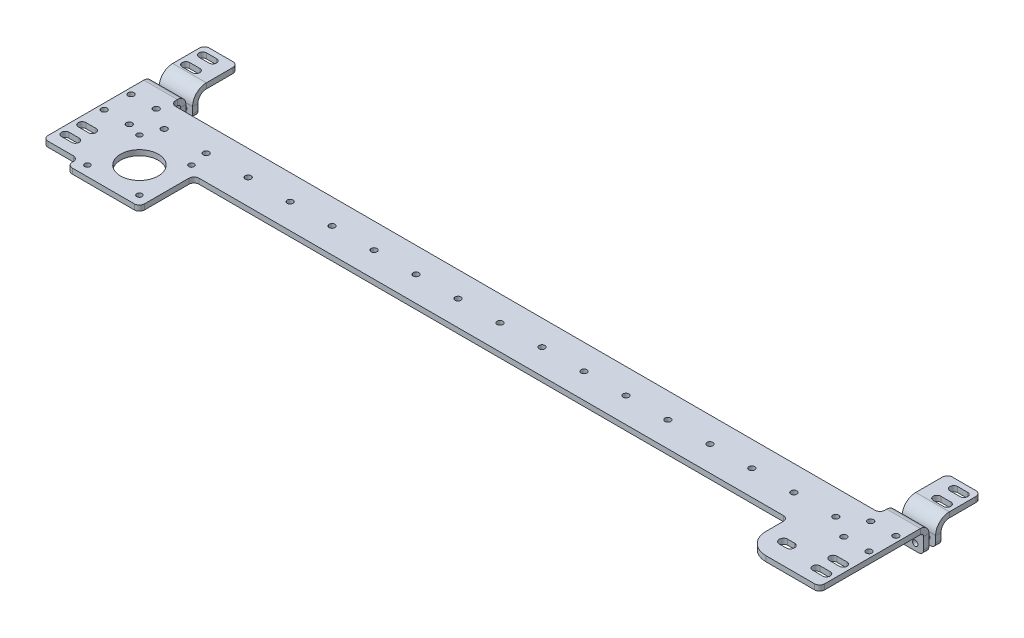
from build123d import *

# Parameters (mm, degrees)
SKETCH1_W                    = 462.5
SKETCH1_H                    = 30
SKETCH1_R                    = 1.75
BOSS_EXTRUDE1_DEPTH          = 3.175
SKETCH2_R                    = 1.6
BOSS_EXTRUDE2_DEPTH          = 3.175
SKETCH2_3_R                  = 1.6
CUT_EXTRUDE1_DEPTH           = 3.175
SKETCH14_W                   = 20
SKETCH14_H                   = 3.175
BOSS_EXTRUDE4_DEPTH          = 6
FILLET1_R                    = 3
EDGE_FLANGE1_START           = -231.25
EDGE_FLANGE1_DEPTH           = 462.5
EDGE_FLANGE1_START_2         = -211.25
EDGE_FLANGE1_2_DEPTH         = 422.5
EDGE_FLANGE1_3_DEPTH         = 20
EDGE_FLANGE1_START_3         = 211.25
EDGE_FLANGE1_4_DEPTH         = 20
FILLET2_R                    = 3
BASE_FLANGE1_START           = 3.175
BASE_FLANGE1_DEPTH           = 3.175
EDGE_FLANGE2_STRIP_W         = 22.7
EDGE_FLANGE2_STRIP_H         = 3.175
EDGE_FLANGE2_STRIP_CUT_DEPTH = 20
EDGE_FLANGE2_DEPTH           = 20
CUT_EXTRUDE2_DEPTH           = 3.175
FILLET3_R                    = 3
SKETCH41_R                   = 1.6
CUT_EXTRUDE3_DEPTH           = 245.609312221


# Read off the part's stored shape, not the designer's step: Edge-Flange1
# Sheet-metal steps are written as plain solids
with BuildPart() as part:
    # Sketch1 → Boss-Extrude1 (new body)
    with BuildSketch(Plane(origin=(0, 0, 0), x_dir=(1, 0, 0), z_dir=(0, 1, 0))):
        Rectangle(SKETCH1_W, SKETCH1_H)
        with Locations(Location((-227.75, 8, 0), (0, 0, 270))):
            Circle(SKETCH1_R, mode=Mode.SUBTRACT)
        with Locations(Location((-212.75, 8, 0), (0, 0, 270))):
            Circle(SKETCH1_R, mode=Mode.SUBTRACT)
        with Locations(Location((-227.75, -8, 0), (0, 0, 270))):
            Circle(SKETCH1_R, mode=Mode.SUBTRACT)
        with Locations(Location((-212.75, -8, 0), (0, 0, 270))):
            Circle(SKETCH1_R, mode=Mode.SUBTRACT)
        with Locations(Location((-200, 0, 0), (0, 0, 270))):
            Circle(SKETCH1_R, mode=Mode.SUBTRACT)
        with Locations(Location((-175, 0, 0), (0, 0, 270))):
            Circle(SKETCH1_R, mode=Mode.SUBTRACT)
        with Locations(Location((-150, 0, 0), (0, 0, 270))):
            Circle(SKETCH1_R, mode=Mode.SUBTRACT)
        with Locations(Location((-125, 0, 0), (0, 0, 270))):
            Circle(SKETCH1_R, mode=Mode.SUBTRACT)
        with Locations(Location((-100, 0, 0), (0, 0, 270))):
            Circle(SKETCH1_R, mode=Mode.SUBTRACT)
        with Locations(Location((-75, 0, 0), (0, 0, 270))):
            Circle(SKETCH1_R, mode=Mode.SUBTRACT)
        with Locations(Location((-50, 0, 0), (0, 0, 270))):
            Circle(SKETCH1_R, mode=Mode.SUBTRACT)
        with Locations(Location((-25, 0, 0), (0, 0, 270))):
            Circle(SKETCH1_R, mode=Mode.SUBTRACT)
        with Locations(Location((0, 0, 0), (0, 0, 270))):
            Circle(SKETCH1_R, mode=Mode.SUBTRACT)
        with Locations(Location((25, 0, 0), (0, 0, 270))):
            Circle(SKETCH1_R, mode=Mode.SUBTRACT)
        with Locations(Location((50, 0, 0), (0, 0, 270))):
            Circle(SKETCH1_R, mode=Mode.SUBTRACT)
        with Locations(Location((75, 0, 0), (0, 0, 270))):
            Circle(SKETCH1_R, mode=Mode.SUBTRACT)
        with Locations(Location((212.75, -8, 0), (0, 0, 90))):
            Circle(SKETCH1_R, mode=Mode.SUBTRACT)
        with Locations(Location((212.75, 8, 0), (0, 0, 90))):
            Circle(SKETCH1_R, mode=Mode.SUBTRACT)
        with Locations(Location((227.75, -8, 0), (0, 0, 90))):
            Circle(SKETCH1_R, mode=Mode.SUBTRACT)
        with Locations(Location((227.75, 8, 0), (0, 0, 90))):
            Circle(SKETCH1_R, mode=Mode.SUBTRACT)
        with Locations(Location((100, 0, 0), (0, 0, 270))):
            Circle(SKETCH1_R, mode=Mode.SUBTRACT)
        with Locations(Location((125, 0, 0), (0, 0, 270))):
            Circle(SKETCH1_R, mode=Mode.SUBTRACT)
        with Locations(Location((150, 0, 0), (0, 0, 270))):
            Circle(SKETCH1_R, mode=Mode.SUBTRACT)
        with Locations(Location((175, 0, 0), (0, 0, 270))):
            Circle(SKETCH1_R, mode=Mode.SUBTRACT)
        with Locations(Location((200, 0, 0), (0, 0, 270))):
            Circle(SKETCH1_R, mode=Mode.SUBTRACT)
    extrude(amount=BOSS_EXTRUDE1_DEPTH)

    # Sketch2 → Boss-Extrude2 (add)
    # profile 1 of 2: a face of its own
    with BuildSketch(Plane(origin=(0, 3.175, 0), x_dir=(1, 0, 0), z_dir=(0, 1, 0))):
        with BuildLine():
            Line((-231.25, -40.9), (-210.25, -40.9))
            Line((-210.25, -40.9), (-210.25, -47.5))
            Line((-210.25, -47.5), (-167.25, -47.5))
            Line((-167.25, -47.5), (-167.25, -15))
            Line((-167.25, -15), (-186.391504717, -15))
            ThreePointArc((-186.391504717, -15), (-180.000840842, -18.927891825), (-177.5, -26))
            ThreePointArc((-177.5, -26), (-195.822108175, -34.749159158), (-191.108495283, -15))
            Line((-191.108495283, -15), (-231.25, -15))
            Line((-231.25, -15), (-231.25, -40.9))
        make_face()
        with Locations(Location((-204.25, -41.5, 0), (0, 0, 270))):
            Circle(SKETCH2_R, mode=Mode.SUBTRACT)
        with Locations(Location((-173.25, -41.5, 0), (0, 0, 270))):
            Circle(SKETCH2_R, mode=Mode.SUBTRACT)
        with BuildLine():
            Line((-220.65, -34.5), (-226.65, -34.5))
            ThreePointArc((-226.65, -34.5), (-228.9, -32.25), (-226.65, -30))
            Line((-226.65, -30), (-220.65, -30))
            ThreePointArc((-220.65, -30), (-218.4, -32.25), (-220.65, -34.5))
        make_face(mode=Mode.SUBTRACT)
        with BuildLine():
            Line((-220.65, -24.5), (-226.65, -24.5))
            ThreePointArc((-226.65, -24.5), (-228.9, -22.25), (-226.65, -20))
            Line((-226.65, -20), (-220.65, -20))
            ThreePointArc((-220.65, -20), (-218.4, -22.25), (-220.65, -24.5))
        make_face(mode=Mode.SUBTRACT)
    # profile 2 of 2: a face of its own
    with BuildSketch(Plane(origin=(0, 3.175, 0), x_dir=(1, 0, 0), z_dir=(0, 1, 0))):
        with BuildLine():
            Line((231.25, -15), (186.75, -15))
            Line((186.75, -15), (186.75, -28.4))
            ThreePointArc((186.75, -28.4), (190.411165235, -37.238834765), (199.25, -40.9))
            Line((199.25, -40.9), (231.25, -40.9))
            Line((231.25, -40.9), (231.25, -15))
        make_face()
        with BuildLine():
            ThreePointArc((226.65, -30), (228.9, -32.25), (226.65, -34.5))
            Line((226.65, -34.5), (220.65, -34.5))
            ThreePointArc((220.65, -34.5), (218.4, -32.25), (220.65, -30))
            Line((220.65, -30), (226.65, -30))
        make_face(mode=Mode.SUBTRACT)
        with BuildLine():
            ThreePointArc((197.25, -30.9), (194.75, -28.4), (197.25, -25.9))
            Line((197.25, -25.9), (201.25, -25.9))
            ThreePointArc((201.25, -25.9), (203.75, -28.4), (201.25, -30.9))
            Line((201.25, -30.9), (197.25, -30.9))
        make_face(mode=Mode.SUBTRACT)
        with BuildLine():
            ThreePointArc((226.65, -20), (228.9, -22.25), (226.65, -24.5))
            Line((226.65, -24.5), (220.65, -24.5))
            ThreePointArc((220.65, -24.5), (218.4, -22.25), (220.65, -20))
            Line((220.65, -20), (226.65, -20))
        make_face(mode=Mode.SUBTRACT)
    extrude(amount=-BOSS_EXTRUDE2_DEPTH)

    # Sketch2<3> → Cut-Extrude1 (cut)
    with BuildSketch(Plane(origin=(0, 3.175, 0), x_dir=(1, 0, 0), z_dir=(0, 1, 0))):
        with Locations(Location((-204.25, -10.5, 0), (0, 0, 270))):
            Circle(SKETCH2_3_R)
        with Locations(Location((-173.25, -10.5, 0), (0, 0, 270))):
            Circle(SKETCH2_3_R)
        with BuildLine():
            ThreePointArc((-186.391504717, -15), (-188.75, -14.75), (-191.108495283, -15))
            Line((-191.108495283, -15), (-186.391504717, -15))
        make_face()
        with BuildLine():
            Line((-186.391504717, -15), (-191.108495283, -15))
            ThreePointArc((-191.108495283, -15), (-195.822108175, -34.749159158), (-177.5, -26))
            ThreePointArc((-177.5, -26), (-180.000840842, -18.927891825), (-186.391504717, -15))
        make_face()
    extrude(amount=-CUT_EXTRUDE1_DEPTH, mode=Mode.SUBTRACT)

    # Sketch14 → Boss-Extrude4 (add)
    with BuildSketch(Plane(origin=(0, 0, -15), x_dir=(-1, 0, 0), z_dir=(0, 0, -1))):
        with Locations((-221.25, 1.5875)):
            Rectangle(SKETCH14_W, SKETCH14_H)
        with Locations((221.25, 1.5875)):
            Rectangle(SKETCH14_W, SKETCH14_H)
    extrude(amount=BOSS_EXTRUDE4_DEPTH)

    # Fillet1
    fillet1_edges = [part.edges().sort_by_distance(p)[0] for p in [
        (-167.25, 1.5875, 15),
        (-167.25, 1.5875, 47.5),
        (-210.25, 1.5875, 47.5),
        (-210.25, 1.5875, 40.9),
        (-231.25, 1.5875, 40.9),
        (186.75, 1.5875, 15),
        (231.25, 1.5875, 40.9),
        (211.25, 1.5875, -15),
        (-211.25, 1.5875, -15),
    ]]
    fillet(fillet1_edges, radius=FILLET1_R)

    # Edge-Flange1 outline → Edge-Flange1 (cut)
    with BuildSketch(Plane.YZ.offset(EDGE_FLANGE1_START)):
        with BuildLine():
            Line((3.175, -21), (3.175, -19.095))
            ThreePointArc((3.175, -19.095), (3.081460321, -20.065367693), (2.804286039, -21))
            Line((2.804286039, -21), (3.175, -21))
        make_face()
    extrude(amount=EDGE_FLANGE1_DEPTH, mode=Mode.SUBTRACT)

    # Edge-Flange1 2 outline → Edge-Flange1 2 (cut)
    with BuildSketch(Plane.YZ.offset(EDGE_FLANGE1_START_2)):
        with BuildLine():
            Line((3.175, -17.5075), (0, -17.5075))
            Line((0, -17.5075), (0, -21))
            Line((0, -21), (2.804286039, -21))
            ThreePointArc((2.804286039, -21), (3.081460321, -20.065367693), (3.175, -19.095))
            Line((3.175, -19.095), (3.175, -17.5075))
        make_face()
    extrude(amount=EDGE_FLANGE1_2_DEPTH, mode=Mode.SUBTRACT)

    # Edge-Flange1 3 outline → Edge-Flange1 3 (add)
    with BuildSketch(Plane.YZ.offset(EDGE_FLANGE1_START)):
        with BuildLine():
            Line((0, -21), (0, -19.095))
            ThreePointArc((0, -19.095), (-0.557961582, -20.442038418), (-1.905, -21))
            Line((-1.905, -21), (-11.825, -21))
            Line((-11.825, -21), (-11.825, -24.175))
            Line((-11.825, -24.175), (-1.905, -24.175))
            ThreePointArc((-1.905, -24.175), (0.934806331, -23.307113483), (2.804286039, -21))
            Line((2.804286039, -21), (0, -21))
        make_face()
    extrude(amount=EDGE_FLANGE1_3_DEPTH)

    # Edge-Flange1 4 outline → Edge-Flange1 4 (add)
    with BuildSketch(Plane.YZ.offset(EDGE_FLANGE1_START_3)):
        with BuildLine():
            Line((0, -21), (0, -19.095))
            ThreePointArc((0, -19.095), (-0.557961582, -20.442038418), (-1.905, -21))
            Line((-1.905, -21), (-11.825, -21))
            Line((-11.825, -21), (-11.825, -24.175))
            Line((-11.825, -24.175), (-1.905, -24.175))
            ThreePointArc((-1.905, -24.175), (0.934806331, -23.307113483), (2.804286039, -21))
            Line((2.804286039, -21), (0, -21))
        make_face()
    extrude(amount=EDGE_FLANGE1_4_DEPTH)

    # Fillet2
    fillet2_edges = [part.edges().sort_by_distance(p)[0] for p in [
        (211.25, -11.825, -22.5875),
        (231.25, -11.825, -22.5875),
        (-231.25, -11.825, -22.5875),
        (-211.25, -11.825, -22.5875),
    ]]
    fillet(fillet2_edges, radius=FILLET2_R)


with BuildPart() as body_2:
    # Sketch31 → Base-Flange1 (new body)
    with BuildSketch(Plane(origin=(0, 0, -28.175), x_dir=(-1, 0, 0), z_dir=(0, 0, -1)).offset(BASE_FLANGE1_START)):
        with BuildLine():
            Line((-231.25, 3.175), (-211.25, 3.175))
            Line((-211.25, 3.175), (-211.25, -8.825))
            ThreePointArc((-211.25, -8.825), (-212.128679656, -10.946320344), (-214.25, -11.825))
            Line((-214.25, -11.825), (-228.25, -11.825))
            ThreePointArc((-228.25, -11.825), (-230.371320344, -10.946320344), (-231.25, -8.825))
            Line((-231.25, -8.825), (-231.25, 3.175))
        make_face()
    extrude(amount=-BASE_FLANGE1_DEPTH)

    # Edge-Flange2 strip (across the edge) → Edge-Flange2 strip cut (cut)
    with BuildSketch(Plane(origin=(211.25, 3.175, -31.35), x_dir=(0, -1, 0), z_dir=(1, 0, 0))):
        with Locations((-3.175, -1.5875)):
            Rectangle(EDGE_FLANGE2_STRIP_W, EDGE_FLANGE2_STRIP_H)
    extrude(amount=EDGE_FLANGE2_STRIP_CUT_DEPTH, mode=Mode.SUBTRACT)

    # Edge-Flange2 section (across the edge) → Edge-Flange2 (add)
    with BuildSketch(Plane(origin=(211.25, 3.175, -31.35), x_dir=(0, -1, 0), z_dir=(1, 0, 0))):
        with BuildLine():
            Line((0, 5), (0, 23.825))
            Line((0, 23.825), (3.175, 23.825))
            Line((3.175, 23.825), (3.175, 5))
            ThreePointArc((3.175, 5), (4.639466094, 1.464466094), (8.175, 0))
            Line((8.175, 0), (8.175, -3.175))
            ThreePointArc((8.175, -3.175), (2.394402064, -0.780597936), (0, 5))
        make_face()
    extrude(amount=EDGE_FLANGE2_DEPTH)

    # Sketch37 → Cut-Extrude2 (cut)
    with BuildSketch(Plane(origin=(0, 3.175, 0), x_dir=(1, 0, 0), z_dir=(0, 1, 0))):
        with BuildLine():
            Line((226.65, 37.35), (220.65, 37.35))
            ThreePointArc((220.65, 37.35), (218.4, 39.6), (220.65, 41.85))
            Line((220.65, 41.85), (226.65, 41.85))
            ThreePointArc((226.65, 41.85), (228.9, 39.6), (226.65, 37.35))
        make_face()
        with BuildLine():
            Line((226.65, 47.35), (220.65, 47.35))
            ThreePointArc((220.65, 47.35), (218.4, 49.6), (220.65, 51.85))
            Line((220.65, 51.85), (226.65, 51.85))
            ThreePointArc((226.65, 51.85), (228.9, 49.6), (226.65, 47.35))
        make_face()
    extrude(amount=-CUT_EXTRUDE2_DEPTH, mode=Mode.SUBTRACT)

    # Fillet3
    fillet3_edges = [body_2.edges().sort_by_distance(p)[0] for p in [
        (211.25, 1.5875, -55.175),
        (231.25, 1.5875, -55.175),
    ]]
    fillet(fillet3_edges, radius=FILLET3_R)


with BuildPart() as body_3:
    # Mirror2: mirrored copy
    add(body_2.part.mirror(Plane(origin=(0, 0, 0), x_dir=(0, 0, 1), z_dir=(1, 0, 0))))


with BuildPart() as cut_extrude3_tool:
    # Sketch41 → Cut-Extrude3 (new, through all)
    with BuildSketch(Plane(origin=(0, 0, -31.35), x_dir=(-1, 0, 0), z_dir=(0, 0, -1))):
        with Locations(Location((-226.25, -7.825, 0), (0, 0, 90))):
            Circle(SKETCH41_R)
        with Locations(Location((-216.25, -7.825, 0), (0, 0, 90))):
            Circle(SKETCH41_R)
    cut_extrude3 = extrude(amount=-CUT_EXTRUDE3_DEPTH)


with BuildPart() as part_1:
    add(part.part)

    # Cut-Extrude3: cut by cut_extrude3_tool
    add(cut_extrude3_tool.part, mode=Mode.SUBTRACT)


with BuildPart() as body_2_1:
    add(body_2.part)

    # Cut-Extrude3: cut by cut_extrude3_tool
    add(cut_extrude3_tool.part, mode=Mode.SUBTRACT)


with BuildPart() as mirror3_tool:
    # Mirror3: Cut-Extrude3 across plane
    add(cut_extrude3.mirror(Plane(origin=(0, 0, 0), x_dir=(0, 0, 1), z_dir=(1, 0, 0))))


with BuildPart() as part_2:
    add(part_1.part)

    # Mirror3: cut by mirror3_tool
    add(mirror3_tool.part, mode=Mode.SUBTRACT)


with BuildPart() as body_3_1:
    add(body_3.part)

    # Mirror3: cut by mirror3_tool
    add(mirror3_tool.part, mode=Mode.SUBTRACT)


solid = Compound([body_2_1.part, part_2.part, body_3_1.part])
